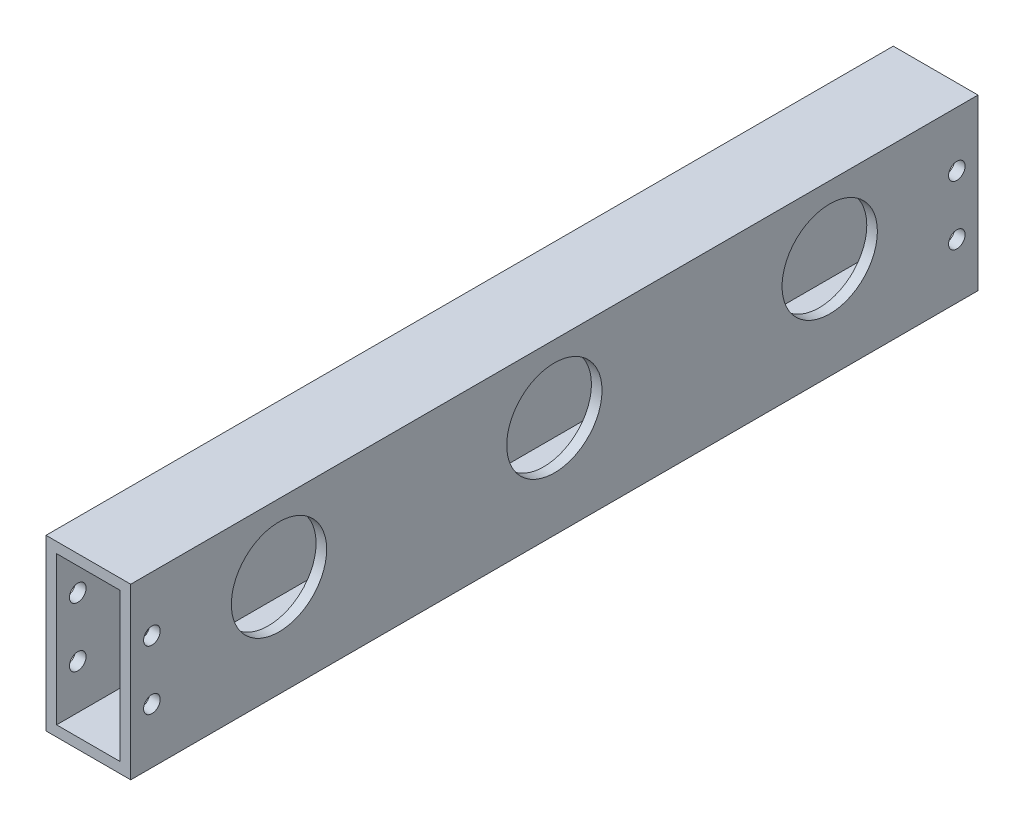
from build123d import *

# Parameters (mm, degrees)
SKETCH1_W              = 254
SKETCH1_H              = 50.8
BOSS_EXTRUDE1_DEPTH    = 25.4
SHELL1_T               = -3.175
SKETCH2_R              = 14.2875
CUT_EXTRUDE1_DEPTH     = 132.982271537
F_10_CLEARANCE_HOLE1_D = 4.9784


with BuildPart() as part:
    # Sketch1 → Boss-Extrude1 (new body)
    with BuildSketch(Plane(origin=(0, 0, 0), x_dir=(0, 0, -1), z_dir=(1, 0, 0))):
        Rectangle(SKETCH1_W, SKETCH1_H)
    extrude(amount=BOSS_EXTRUDE1_DEPTH)

    # Shell1
    shell1_openings = [part.faces().sort_by_distance(p)[0] for p in [
        (12.7, 0, -127),
        (12.7, 0, 127),
    ]]
    offset(amount=SHELL1_T, openings=shell1_openings, kind=Kind.INTERSECTION)

    # Sketch2 → Cut-Extrude1 (cut, through all)
    with BuildSketch(Plane(origin=(25.4, 0, 0), x_dir=(0, 0, -1), z_dir=(1, 0, 0))):
        with Locations((0, 5.08)):
            Circle(SKETCH2_R)
        with Locations((-82.55, 5.08)):
            Circle(SKETCH2_R)
        with Locations((82.55, 5.08)):
            Circle(SKETCH2_R)
    extrude(amount=-CUT_EXTRUDE1_DEPTH, mode=Mode.SUBTRACT)

    # #10 Clearance Hole1 (through all)
    with Locations(Plane(origin=(25.4, 0, 0), x_dir=(0, 0, -1), z_dir=(1, 0, 0))):
        with Locations((-120.65, 8.89), (-120.65, -8.89)):
            f_10_clearance_hole1 = Hole(F_10_CLEARANCE_HOLE1_D / 2)

    # Mirror1: #10 Clearance Hole1 across plane
    add(f_10_clearance_hole1.mirror(Plane.XY), mode=Mode.SUBTRACT)


solid = part.part
